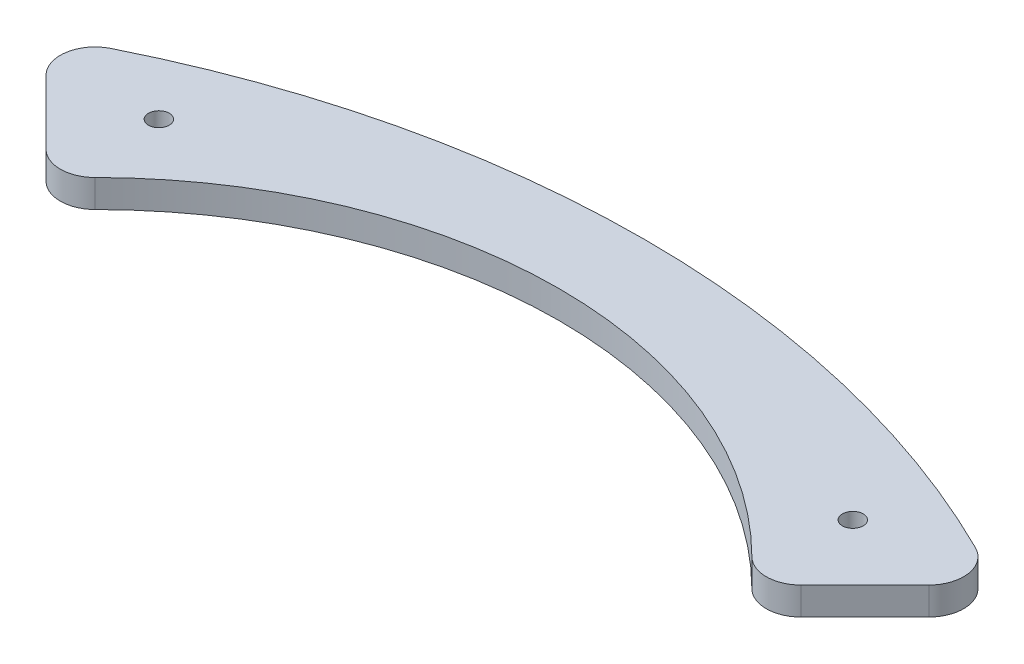
from build123d import *

# Parameters (mm, degrees)
BOSS_EXTRUDE1_DEPTH = 4
FILLET1_R           = 5
CUT_EXTRUDE1_REACH  = 156.44
SKETCH2_R           = 1.5


with BuildPart() as part:
    # Sketch1 → Boss-Extrude1 (new body)
    with BuildSketch(Plane(origin=(0, 0, 0), x_dir=(1, 0, 0), z_dir=(0, 1, 0))):
        with BuildLine():
            Line((-68.408481347, 122.148596717), (-50.730811817, 104.470927187))
            ThreePointArc((-50.730811817, 104.470927187), (0, 127.705818568), (50.730811817, 104.470927187))
            Line((50.730811817, 104.470927187), (68.408481347, 122.148596717))
            ThreePointArc((68.408481347, 122.148596717), (0, 140), (-68.408481347, 122.148596717))
        make_face()
    extrude(amount=BOSS_EXTRUDE1_DEPTH)

    # Fillet1
    fillet1_edges = [part.edges().sort_by_distance(p)[0] for p in [
        (68.408481347, 2, -122.148596717),
        (50.730811817, 2, -104.470927187),
        (-68.408481347, 2, -122.148596717),
        (-50.730811817, 2, -104.470927187),
    ]]
    fillet(fillet1_edges, radius=FILLET1_R)

    # Sketch2 → Cut-Extrude1 (cut, up to next)
    with BuildSketch(Plane(origin=(0, 4, 0), x_dir=(1, 0, 0), z_dir=(0, 1, 0)), mode=Mode.PRIVATE) as cut_extrude1_sk1:
        with Locations((-50, 120)):
            Circle(SKETCH2_R)
    cut_extrude1_tool1 = extrude(cut_extrude1_sk1.sketch, amount=-CUT_EXTRUDE1_REACH, mode=Mode.PRIVATE) & part.part
    # Sketch2 → Cut-Extrude1 (cut, up to next)
    with BuildSketch(Plane(origin=(0, 4, 0), x_dir=(1, 0, 0), z_dir=(0, 1, 0)), mode=Mode.PRIVATE) as cut_extrude1_sk2:
        with Locations((50, 120)):
            Circle(SKETCH2_R)
    cut_extrude1_tool2 = extrude(cut_extrude1_sk2.sketch, amount=-CUT_EXTRUDE1_REACH, mode=Mode.PRIVATE) & part.part
    add(cut_extrude1_tool1.solids().sort_by_distance((-50, 4, -120))[0], mode=Mode.SUBTRACT)
    add(cut_extrude1_tool2.solids().sort_by_distance((50, 4, -120))[0], mode=Mode.SUBTRACT)


solid = part.part
